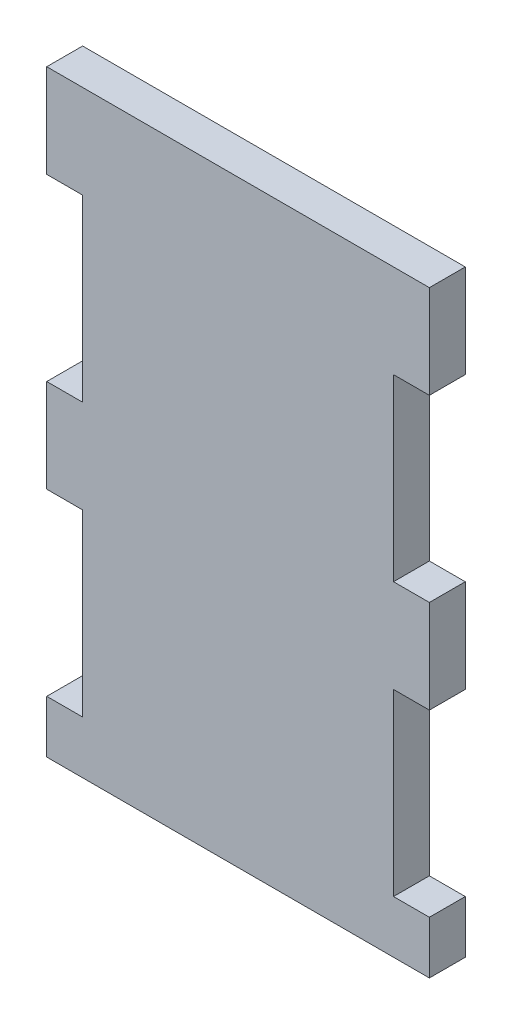
from build123d import *

# Parameters (mm, degrees)
SKETCH1_W           = 32
SKETCH1_H           = 50
BOSS_EXTRUDE1_DEPTH = 3
SKETCH2_W           = 3
SKETCH2_H           = 15
CUT_EXTRUDE1_DEPTH  = 53.999062732
LPATTERN1_COUNT     = 3
LPATTERN1_PITCH     = 22.8


with BuildPart() as part:
    # Sketch1 → Boss-Extrude1 (new body)
    with BuildSketch(Plane.XY):
        with Locations((-24.993460648, -8.457986111)):
            Rectangle(SKETCH1_W, SKETCH1_H)
    extrude(amount=BOSS_EXTRUDE1_DEPTH)

    # Sketch2 → Cut-Extrude1 (cut, through all)
    with BuildSketch(Plane.XY.offset(3)):
        with Locations((-39.493460648, 1.242013889)):
            Rectangle(SKETCH2_W, SKETCH2_H)
        with Locations((-10.493460648, 1.242013889)):
            Rectangle(SKETCH2_W, SKETCH2_H)
    cut_extrude1 = extrude(amount=-CUT_EXTRUDE1_DEPTH, mode=Mode.SUBTRACT)

    # LPattern1: Cut-Extrude1 ×3
    with Locations(*[(0, -i * LPATTERN1_PITCH, 0) for i in range(1, LPATTERN1_COUNT)]):
        add(cut_extrude1, mode=Mode.SUBTRACT)


solid = part.part
